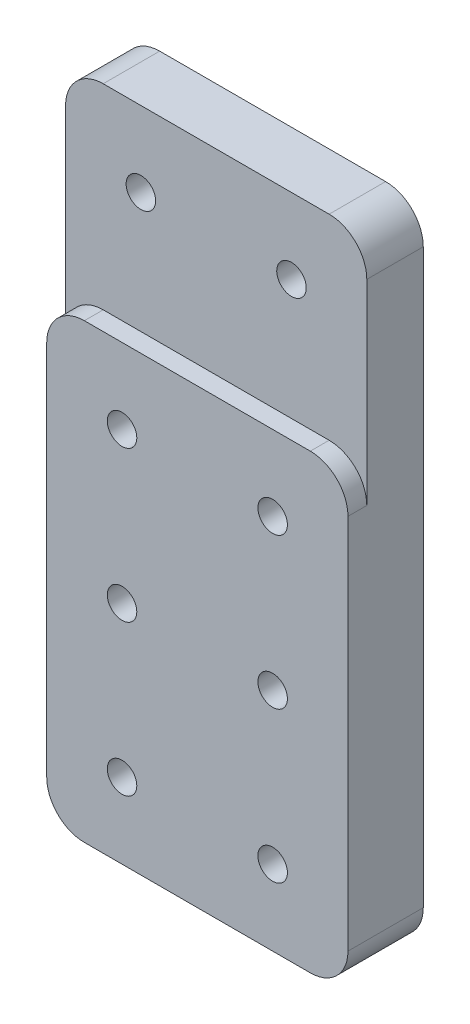
from build123d import *

# Parameters (mm, degrees)
SKETCH2_W           = 50.8
SKETCH2_H           = 109.22
BOSS_EXTRUDE1_DEPTH = 12.7
SKETCH3_R           = 2.4892
CUT_EXTRUDE1_DEPTH  = 122.123649218
FILLET1_R           = 6.35
SKETCH4_W           = 3.175
SKETCH4_H           = 33.02
CUT_EXTRUDE2_DEPTH  = 122.123649218
FILLET3_R           = 6.35


with BuildPart() as part:
    # Sketch2 → Boss-Extrude1 (new body)
    with BuildSketch(Plane.XY):
        with Locations((25.4, 54.61)):
            Rectangle(SKETCH2_W, SKETCH2_H)
    extrude(amount=-BOSS_EXTRUDE1_DEPTH)

    # Sketch3 → Cut-Extrude1 (cut, through all)
    with BuildSketch(Plane.XY):
        with Locations((12.7, 96.52)):
            Circle(SKETCH3_R)
        with Locations((38.1, 96.52)):
            Circle(SKETCH3_R)
        with Locations((12.7, 63.5)):
            Circle(SKETCH3_R)
        with Locations((12.7, 38.1)):
            Circle(SKETCH3_R)
        with Locations((12.7, 12.7)):
            Circle(SKETCH3_R)
        with Locations((12.7, -12.7)):
            Circle(SKETCH3_R)
        with Locations((12.7, -38.1)):
            Circle(SKETCH3_R)
        with Locations((38.1, 38.1)):
            Circle(SKETCH3_R)
        with Locations((38.1, 12.7)):
            Circle(SKETCH3_R)
        with Locations((38.1, -12.7)):
            Circle(SKETCH3_R)
        with Locations((38.1, -38.1)):
            Circle(SKETCH3_R)
        with Locations((38.1, 63.5)):
            Circle(SKETCH3_R)
    extrude(amount=-CUT_EXTRUDE1_DEPTH, mode=Mode.SUBTRACT)

    # Fillet1
    fillet1_edges = [part.edges().sort_by_distance(p)[0] for p in [
        (0, 0, -6.35),
        (50.8, 0, -6.35),
        (50.8, 109.22, -6.35),
        (0, 109.22, -6.35),
    ]]
    fillet(fillet1_edges, radius=FILLET1_R)

    # Sketch4 → Cut-Extrude2 (cut, through all)
    with BuildSketch(Plane.ZY):
        with Locations((-1.5875, 92.71)):
            Rectangle(SKETCH4_W, SKETCH4_H)
    extrude(amount=-CUT_EXTRUDE2_DEPTH, mode=Mode.SUBTRACT)

    # Fillet3
    fillet3_edges = [part.edges().sort_by_distance(p)[0] for p in [
        (50.8, 76.2, -1.5875),
        (0, 76.2, -1.5875),
    ]]
    fillet(fillet3_edges, radius=FILLET3_R)


solid = part.part
